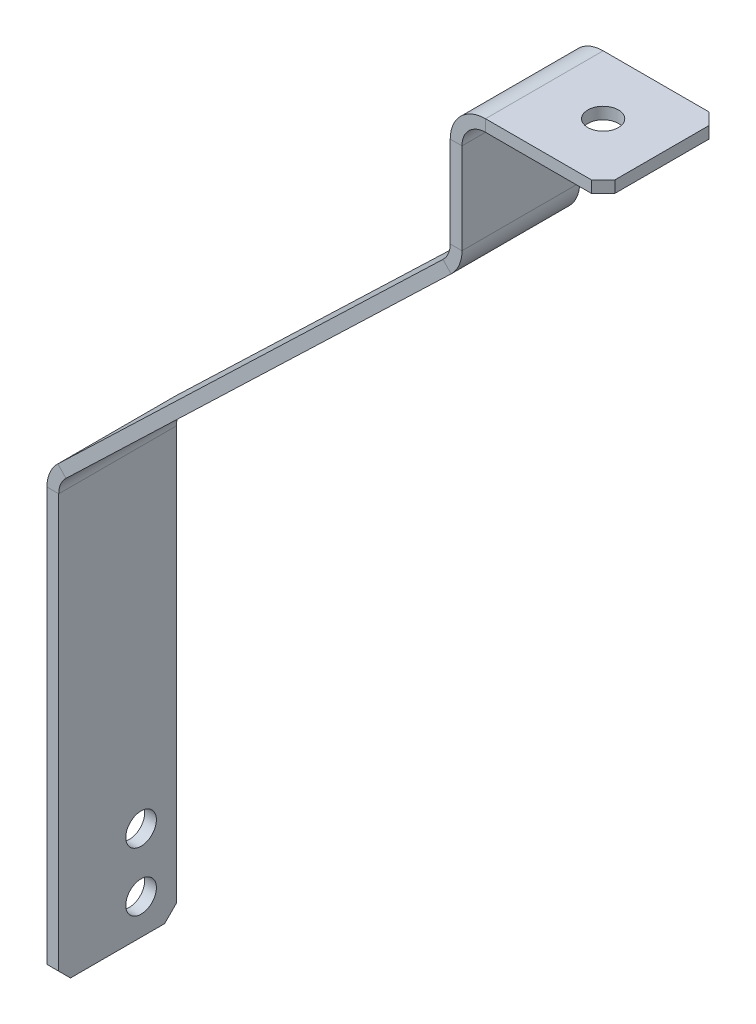
from build123d import *

# Parameters (mm, degrees)
SM_BASE_FLANGE_1_DEPTH = 50
SKETCH_6_R             = 6.5
CUT_EXTRUDE_1_DEPTH    = 10
SKETCH_7_R             = 6.5
CUT_EXTRUDE_2_DEPTH    = 10
OTHER_START            = 160.088975261
OTHER_1_OUTLINE_W      = 10
OTHER_1_OUTLINE_H      = 8
OTHER_1_DEPTH          = 3.535533906
OTHER_START_2          = 195.44431432
OTHER_1_2_OUTLINE_W    = 39
OTHER_1_2_OUTLINE_H    = 8
OTHER_1_2_DEPTH        = 3.535533906
OTHER_1_3_OUTLINE_W    = 7
OTHER_1_3_OUTLINE_H    = 10
OTHER_1_3_DEPTH        = 3.535533906
OTHER_START_3          = -35.355339059
OTHER_1_4_OUTLINE_W    = 7
OTHER_1_4_OUTLINE_H    = 38
OTHER_1_4_DEPTH        = 3.535533906


# Read off the part's stored shape, not the designer's step: Затупленный угол1
# Sheet-metal steps are written as plain solids
with BuildPart() as part:
    # Sketch 1 → Базовая кромка1 (new body)
    with BuildSketch(Plane.XY):
        with BuildLine():
            Line((231.4, 404.5), (181.4, 404.5))
            ThreePointArc((181.4, 404.5), (174.328932188, 401.571067812), (171.4, 394.5))
            Line((171.4, 394.5), (171.4, 355.894452277))
            ThreePointArc((171.4, 355.894452277), (170.198513935, 350.012189687), (166.786531576, 345.072254634))
            Line((166.786531576, 345.072254634), (3.075645616, 187.951830244))
            ThreePointArc((3.075645616, 187.951830244), (0.80099071, 184.658540209), (0, 180.737031815))
            Line((0, 180.737031815), (0, 0))
            Line((0, 0), (-5, 0))
            Line((-5, 0), (-5, 180.737031815))
            ThreePointArc((-5, 180.737031815), (-3.798513935, 186.619294405), (-0.386531576, 191.559229458))
            Line((-0.386531576, 191.559229458), (163.324354384, 348.679653848))
            ThreePointArc((163.324354384, 348.679653848), (165.59900929, 351.972943883), (166.4, 355.894452277))
            Line((166.4, 355.894452277), (166.4, 394.5))
            ThreePointArc((166.4, 394.5), (170.793398282, 405.106601718), (181.4, 409.5))
            Line((181.4, 409.5), (231.4, 409.5))
            Line((231.4, 409.5), (231.4, 404.5))
        make_face()
    extrude(amount=SM_BASE_FLANGE_1_DEPTH)

    # Эскиз6 → Вырез-Вытянуть1 (cut)
    with BuildSketch(Plane.ZY.offset(5)):
        with Locations(Location((15, 15, 0), (0, 0, 270))):
            Circle(SKETCH_6_R)
        with Locations(Location((15, 40, 0), (0, 0, 270))):
            Circle(SKETCH_6_R)
    extrude(amount=-CUT_EXTRUDE_1_DEPTH, mode=Mode.SUBTRACT)

    # Эскиз7 → Вырез-Вытянуть2 (cut)
    with BuildSketch(Plane(origin=(0, 409.5, 0), x_dir=(1, 0, 0), z_dir=(0, 1, 0))):
        with Locations(Location((206.4, -25, 0), (0, 0, 180))):
            Circle(SKETCH_7_R)
    extrude(amount=-CUT_EXTRUDE_2_DEPTH, mode=Mode.SUBTRACT)

    # Other 1 outline → Other 1 (cut)
    with BuildSketch(Plane(origin=(0, 0, 0), x_dir=(0.707106781186548, 0, 0.707106781186547), z_dir=(0.707106781186547, 0, -0.707106781186548)).offset(OTHER_START)):
        with Locations((164, -407)):
            Rectangle(OTHER_1_OUTLINE_W, OTHER_1_OUTLINE_H)
    extrude(amount=OTHER_1_DEPTH, mode=Mode.SUBTRACT)

    # Other 1 2 outline → Other 1 2 (cut)
    with BuildSketch(Plane(origin=(0, 0, 0), x_dir=(0.707106781186548, 0, -0.707106781186547), z_dir=(0.707106781186547, 0, 0.707106781186548)).offset(OTHER_START_2)):
        with Locations((142.5, 407)):
            Rectangle(OTHER_1_2_OUTLINE_W, OTHER_1_2_OUTLINE_H)
    extrude(amount=OTHER_1_2_DEPTH, mode=Mode.SUBTRACT)

    # Other 1 3 outline → Other 1 3 (cut)
    with BuildSketch(Plane(origin=(0, 0, 0), x_dir=(1, 0, 0), z_dir=(0, 0.707106781186547, 0.707106781186548))):
        with Locations((-2.5, 0)):
            Rectangle(OTHER_1_3_OUTLINE_W, OTHER_1_3_OUTLINE_H)
    extrude(amount=OTHER_1_3_DEPTH, mode=Mode.SUBTRACT)

    # Other 1 4 outline → Other 1 4 (cut)
    with BuildSketch(Plane(origin=(0, 0, 0), x_dir=(1, 0, 0), z_dir=(0, 0.707106781186547, -0.707106781186548)).offset(OTHER_START_3)):
        with Locations((-2.5, -21)):
            Rectangle(OTHER_1_4_OUTLINE_W, OTHER_1_4_OUTLINE_H)
    extrude(amount=OTHER_1_4_DEPTH, mode=Mode.SUBTRACT)


solid = part.part
